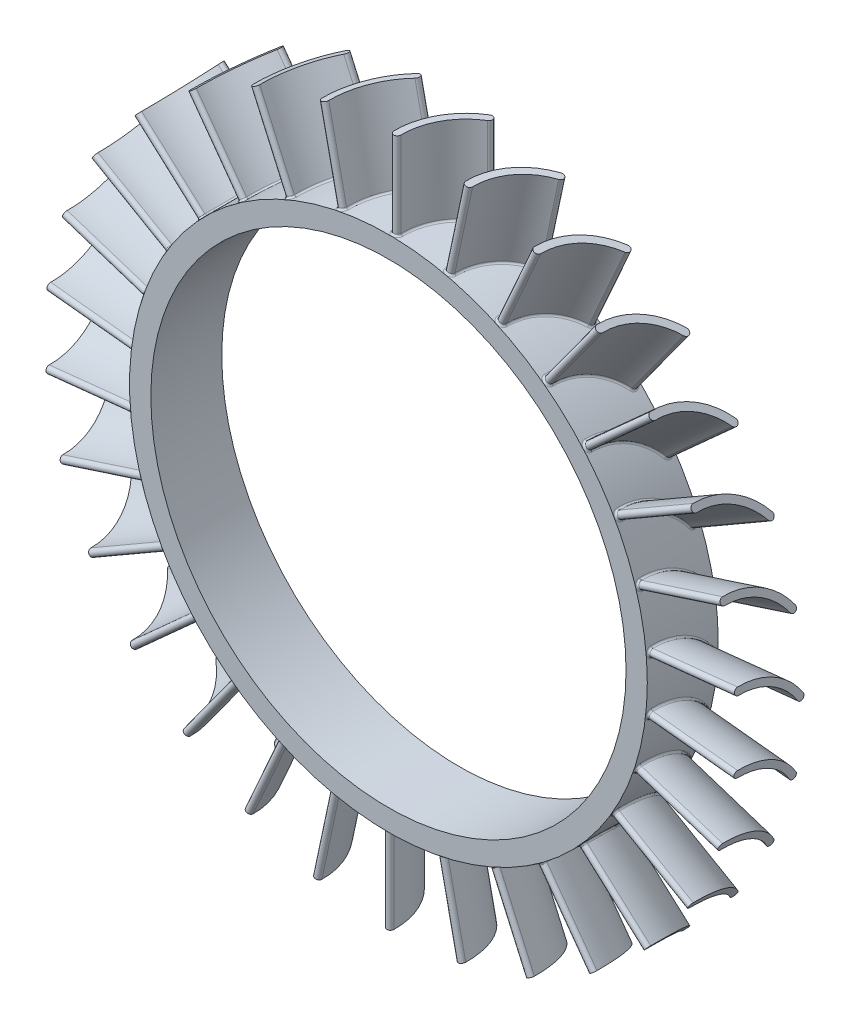
from build123d import *

# Parameters (mm, degrees)
SKETCH1_R                = 73
SKETCH1_R_2              = 67
BOSS_EXTRUDE1_DEPTH      = 10
BOSS_EXTRUDE2_START      = 68
BOSS_EXTRUDE2_DEPTH      = 29.5
FILLET1_R                = 0.5
CIRPATTERN1_COUNT        = 30
FILLET1_OF_CIRPATTERN1_R = 0.5


with BuildPart() as part:
    # Sketch1 → Boss-Extrude1 (new, symmetric)
    with BuildSketch(Plane.XY):
        Circle(SKETCH1_R)
        Circle(SKETCH1_R_2, mode=Mode.SUBTRACT)
    extrude(amount=BOSS_EXTRUDE1_DEPTH, both=True)

    # Sketch2 → Boss-Extrude2 (add)
    with BuildSketch(Plane(origin=(0, 0, 0), x_dir=(1, 0, 0), z_dir=(0, 1, 0)).offset(BOSS_EXTRUDE2_START)):
        with BuildLine():
            ThreePointArc((-0.015411203, -8.5), (2.48026862, 1.546814045), (9.664759511, 9))
            ThreePointArc((9.664759511, 9), (11.037278052, 8.659129273), (10.696407325, 7.286610731))
            ThreePointArc((10.696407325, 7.286610731), (4.230365523, 0.578743372), (1.984253683, -8.463389269))
            ThreePointArc((1.984253683, -8.463389269), (1.002726606, -9.481527077), (-0.015411203, -8.5))
        make_face()
    boss_extrude2 = extrude(amount=BOSS_EXTRUDE2_DEPTH)

    # Fillet1
    fillet1_edges = [part.edges().sort_by_distance(p)[0] for p in [
        (2.485414926, 72.957677557, -1.556111808),
        (2.485414926, 72.957677557, -1.556111808),
        (4.2367874, 72.876948583, -0.59034287),
        (1.002786497, 72.993112136, 9.481525977),
    ]]
    fillet(fillet1_edges, radius=FILLET1_R)

    # CirPattern1: Boss-Extrude2 ×30 about axis
    cirpattern1_axis = Axis((0, 0, 10), (0, 0, -1))
    for i in range(1, CIRPATTERN1_COUNT):
        add(boss_extrude2.rotate(cirpattern1_axis, i * 360 / CIRPATTERN1_COUNT))

    # Fillet1 of CirPattern1
    fillet1_of_cirpattern1_edges = [part.edges().sort_by_distance(p)[0] for p in [
        (17.599856746, 70.846630438, -1.556111808),
        (17.599856746, 70.846630438, -1.556111808),
        (19.296173031, 70.403534774, -0.59034287),
        (16.156994568, 71.18954647, 9.481525977),
        (31.945100372, 65.639245609, -1.556111808),
        (31.945100372, 65.639245609, -1.556111808),
        (33.512223308, 64.853148661, -0.59034287),
        (30.605064447, 66.274656017, 9.481525977),
        (44.894189823, 57.563110774, -1.556111808),
        (44.894189823, 57.563110774, -1.556111808),
        (46.263628617, 56.468368751, -0.59034287),
        (43.71554615, 58.463245076, 9.481525977),
        (55.881187752, 46.971191781, -1.556111808),
        (55.881187752, 46.971191781, -1.556111808),
        (56.993091358, 45.615650162, -0.59034287),
        (54.915448716, 48.096709787, 9.481525977),
        (64.425909628, 34.326406314, -1.556111808),
        (64.425909628, 34.326406314, -1.556111808),
        (65.231682523, 32.769308773, -0.59034287),
        (63.71528266, 35.628117487, 9.481525977),
        (70.154910104, 20.181392174, -1.556111808),
        (70.154910104, 20.181392174, -1.556111808),
        (70.619336146, 18.490791346, -0.59034287),
        (69.730453011, 21.60240549, 9.481525977),
        (72.817804368, 5.154354356, -1.556111808),
        (72.817804368, 5.154354356, -1.556111808),
        (72.92058591, 3.404137608, -0.59034287),
        (72.698067962, 6.632564713, 9.481525977),
        (72.298211163, -10.097953481, -1.556111808),
        (72.298211163, -10.097953481, -1.556111808),
        (72.034856158, -11.831293278, -0.59034287),
        (72.488428499, -8.627150968, 9.481525977),
        (68.618839204, -24.908932296, -1.556111808),
        (68.618839204, -24.908932296, -1.556111808),
        (68.00085753, -26.549639875, -0.59034287),
        (69.110696872, -23.509818755, 9.481525977),
        (61.940494702, -38.631271243, -1.556111808),
        (61.940494702, -38.631271243, -1.556111808),
        (60.994895124, -40.10763981, -0.59034287),
        (62.712496163, -37.364994649, 9.481525977),
        (52.555053359, -50.665238264, -1.556111808),
        (52.555053359, -50.665238264, -1.556111808),
        (51.323163115, -51.912743428, -0.59034287),
        (53.573458443, -49.58714098, 9.481525977),
        (40.872703996, -60.484891253, -1.556111808),
        (40.872703996, -60.484891253, -1.556111808),
        (39.408362602, -61.449011053, -0.59034287),
        (42.093003515, -59.642091305, 9.481525977),
        (27.40402134, -67.661064256, -1.556111808),
        (27.40402134, -67.661064256, -1.556111808),
        (25.771227541, -68.299662029, -0.59034287),
        (28.772882348, -67.090396045, 9.481525977),
        (12.737651452, -71.880124077, -1.556111808),
        (12.737651452, -71.880124077, -1.556111808),
        (11.007766172, -72.165290037, -0.59034287),
        (14.195248156, -71.606528542, 9.481525977),
        (-2.485414926, -72.957677557, -1.556111808),
        (-2.485414926, -72.957677557, -1.556111808),
        (-4.2367874, -72.876948583, -0.59034287),
        (-1.002786497, -72.993112136, 9.481525977),
        (-17.599856746, -70.846630438, -1.556111808),
        (-17.599856746, -70.846630438, -1.556111808),
        (-19.296173031, -70.403534774, -0.59034287),
        (-16.156994568, -71.18954647, 9.481525977),
        (-31.945100372, -65.639245609, -1.556111808),
        (-31.945100372, -65.639245609, -1.556111808),
        (-33.512223308, -64.853148661, -0.59034287),
        (-30.605064447, -66.274656017, 9.481525977),
        (-44.894189823, -57.563110774, -1.556111808),
        (-44.894189823, -57.563110774, -1.556111808),
        (-46.263628617, -56.468368751, -0.59034287),
        (-43.71554615, -58.463245076, 9.481525977),
        (-55.881187752, -46.971191781, -1.556111808),
        (-55.881187752, -46.971191781, -1.556111808),
        (-56.993091358, -45.615650162, -0.59034287),
        (-54.915448716, -48.096709787, 9.481525977),
        (-64.425909628, -34.326406314, -1.556111808),
        (-64.425909628, -34.326406314, -1.556111808),
        (-65.231682523, -32.769308773, -0.59034287),
        (-63.71528266, -35.628117487, 9.481525977),
        (-70.154910104, -20.181392174, -1.556111808),
        (-70.154910104, -20.181392174, -1.556111808),
        (-70.619336146, -18.490791346, -0.59034287),
        (-69.730453011, -21.60240549, 9.481525977),
        (-72.817804368, -5.154354356, -1.556111808),
        (-72.817804368, -5.154354356, -1.556111808),
        (-72.92058591, -3.404137608, -0.59034287),
        (-72.698067962, -6.632564713, 9.481525977),
        (-72.298211163, 10.097953481, -1.556111808),
        (-72.298211163, 10.097953481, -1.556111808),
        (-72.034856158, 11.831293278, -0.59034287),
        (-72.488428499, 8.627150968, 9.481525977),
        (-68.618839204, 24.908932296, -1.556111808),
        (-68.618839204, 24.908932296, -1.556111808),
        (-68.00085753, 26.549639875, -0.59034287),
        (-69.110696872, 23.509818755, 9.481525977),
        (-61.940494702, 38.631271243, -1.556111808),
        (-61.940494702, 38.631271243, -1.556111808),
        (-60.994895124, 40.10763981, -0.59034287),
        (-62.712496163, 37.364994649, 9.481525977),
        (-52.555053359, 50.665238264, -1.556111808),
        (-52.555053359, 50.665238264, -1.556111808),
        (-51.323163115, 51.912743428, -0.59034287),
        (-53.573458443, 49.58714098, 9.481525977),
        (-40.872703996, 60.484891253, -1.556111808),
        (-40.872703996, 60.484891253, -1.556111808),
        (-39.408362602, 61.449011053, -0.59034287),
        (-42.093003515, 59.642091305, 9.481525977),
        (-27.40402134, 67.661064256, -1.556111808),
        (-27.40402134, 67.661064256, -1.556111808),
        (-25.771227541, 68.299662029, -0.59034287),
        (-28.772882348, 67.090396045, 9.481525977),
        (-12.737651452, 71.880124077, -1.556111808),
        (-12.737651452, 71.880124077, -1.556111808),
        (-11.007766172, 72.165290037, -0.59034287),
        (-14.195248156, 71.606528542, 9.481525977),
    ]]
    fillet(fillet1_of_cirpattern1_edges, radius=FILLET1_OF_CIRPATTERN1_R)


solid = part.part
